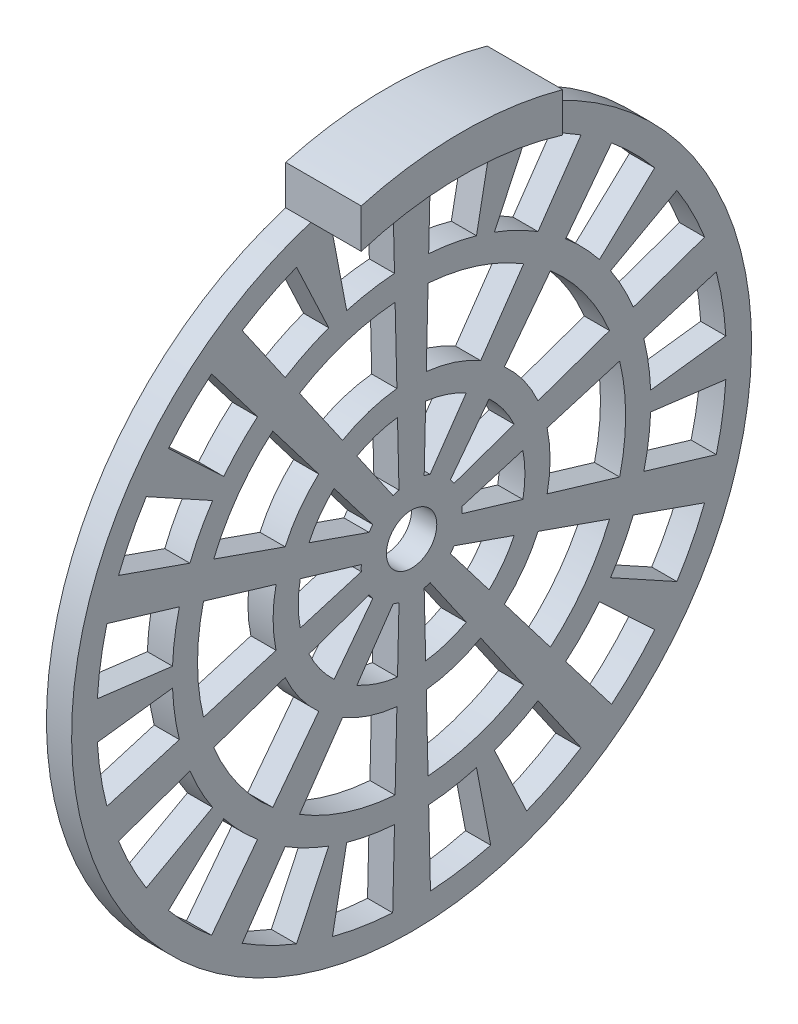
from build123d import *

# Parameters (mm, degrees)
EXTRUDE_START         = -2
EXTRUDE_1_OUTLINE_R   = 27
EXTRUDE_1_OUTLINE_R_2 = 2
EXTRUDE_1_DEPTH       = 2
EXTRUDE_2_DEPTH       = 6


# Read off the part's stored shape, not the designer's step: 填料-伸長1
with BuildPart() as part:
    # 填料-伸長1 outline → 填料-伸長1 (new body)
    with BuildSketch(Plane(origin=(-12, 0, 0), x_dir=(0, 0, -1), z_dir=(1, 0, 0)).offset(EXTRUDE_START)):
        with Locations((-180, -28.843045968)):
            Circle(EXTRUDE_1_OUTLINE_R)
        with BuildLine():
            ThreePointArc((-195.881160253, -48.150784029), (-197.677430395, -46.520954629), (-199.307308392, -44.724728582))
            Line((-199.307308392, -44.724728582), (-194.918503705, -40.609024347))
            ThreePointArc((-194.918503705, -40.609024347), (-193.648293098, -42.0613702), (-192.237337079, -43.377404613))
            Line((-192.237337079, -43.377404613), (-195.881160253, -48.150784029))
        make_face(mode=Mode.SUBTRACT)
        with BuildLine():
            ThreePointArc((-181.499324848, -53.798045968), (-183.910527604, -53.535307385), (-186.284921782, -53.040148237))
            Line((-186.284921782, -53.040148237), (-185.153454458, -47.130798896))
            ThreePointArc((-185.153454458, -47.130798896), (-183.272165017, -47.559160311), (-181.357132, -47.794515376))
            Line((-181.357132, -47.794515376), (-181.499324848, -53.798045968))
        make_face(mode=Mode.SUBTRACT)
        with BuildLine():
            ThreePointArc((-189.138091331, -52.113097253), (-191.350063817, -51.118055538), (-193.455201689, -49.913346097))
            Line((-193.455201689, -49.913346097), (-190.041451376, -44.972808963))
            ThreePointArc((-190.041451376, -44.972808963), (-188.353818884, -45.90803088), (-186.580039232, -46.667273404))
            Line((-186.580039232, -46.667273404), (-189.138091331, -52.113097253))
        make_face(mode=Mode.SUBTRACT)
        with BuildLine():
            ThreePointArc((-201.070664149, -42.297677599), (-202.275316635, -40.192507135), (-203.270298506, -37.98050773))
            Line((-203.270298506, -37.98050773), (-197.604541623, -35.990081315))
            ThreePointArc((-197.604541623, -35.990081315), (-196.788927907, -37.73865723), (-195.800181583, -39.395498855))
            Line((-195.800181583, -39.395498855), (-201.070664149, -42.297677599))
        make_face(mode=Mode.SUBTRACT)
        with BuildLine():
            ThreePointArc((-204.196932222, -35.128622396), (-204.692155609, -32.754241615), (-204.954959427, -30.343045968))
            Line((-204.954959427, -30.343045968), (-198.985191598, -29.593045968))
            ThreePointArc((-198.985191598, -29.593045968), (-198.811237104, -31.514629507), (-198.443295326, -33.408662852))
            Line((-198.443295326, -33.408662852), (-204.196932222, -35.128622396))
        make_face(mode=Mode.SUBTRACT)
        with BuildLine():
            ThreePointArc((-196.524631259, -32.83510831), (-197, -28.843045968), (-196.524631259, -24.850983626))
            Line((-196.524631259, -24.850983626), (-190.76327242, -26.573251523))
            ThreePointArc((-190.76327242, -26.573251523), (-191, -28.843045968), (-190.76327242, -31.112840413))
            Line((-190.76327242, -31.112840413), (-196.524631259, -32.83510831))
        make_face(mode=Mode.SUBTRACT)
        with BuildLine():
            ThreePointArc((-191.022232143, -41.785626799), (-193.753288904, -38.835395257), (-195.715182886, -35.326334244))
            Line((-195.715182886, -35.326334244), (-190.041822003, -33.333236483))
            ThreePointArc((-190.041822003, -33.333236483), (-188.899186938, -35.308683743), (-187.373518602, -37.005841042))
            Line((-187.373518602, -37.005841042), (-191.022232143, -41.785626799))
        make_face(mode=Mode.SUBTRACT)
        with BuildLine():
            ThreePointArc((-181.309714981, -45.792519313), (-185.253288904, -45.011006745), (-188.903068789, -43.3252891))
            Line((-188.903068789, -43.3252891), (-185.48473689, -38.378121282))
            ThreePointArc((-185.48473689, -38.378121282), (-183.399186938, -39.304667647), (-181.167331296, -39.780931397))
            Line((-181.167331296, -39.780931397), (-181.309714981, -45.792519313))
        make_face(mode=Mode.SUBTRACT)
        with BuildLine():
            ThreePointArc((-186.154879946, -35.409434082), (-187.281152949, -34.133113239), (-188.146968705, -32.667559129))
            Line((-188.146968705, -32.667559129), (-183.374409055, -30.990920157))
            ThreePointArc((-183.374409055, -30.990920157), (-183.236067977, -31.194186977), (-183.085499488, -31.388570062))
            Line((-183.085499488, -31.388570062), (-186.154879946, -35.409434082))
        make_face(mode=Mode.SUBTRACT)
        with BuildLine():
            ThreePointArc((-181.11977638, -37.773113205), (-182.781152949, -37.402554615), (-184.343043702, -36.725810166))
            Line((-184.343043702, -36.725810166), (-181.467465499, -32.564140566))
            ThreePointArc((-181.467465499, -32.564140566), (-181.236067978, -32.647272033), (-181, -32.716029314))
            Line((-181, -32.716029314), (-181.11977638, -37.773113205))
        make_face(mode=Mode.SUBTRACT)
        with BuildLine():
            ThreePointArc((-173.715078218, -53.040148237), (-176.089472396, -53.535307385), (-178.500675152, -53.798045968))
            Line((-178.500675152, -53.798045968), (-178.642868, -47.794515376))
            ThreePointArc((-178.642868, -47.794515376), (-176.727834983, -47.559160311), (-174.846545542, -47.130798896))
            Line((-174.846545542, -47.130798896), (-173.715078218, -53.040148237))
        make_face(mode=Mode.SUBTRACT)
        with BuildLine():
            ThreePointArc((-166.544798311, -49.913346097), (-168.649936183, -51.118055538), (-170.861908669, -52.113097253))
            Line((-170.861908669, -52.113097253), (-173.419960768, -46.667273404))
            ThreePointArc((-173.419960768, -46.667273404), (-171.646181116, -45.90803088), (-169.958548624, -44.972808963))
            Line((-169.958548624, -44.972808963), (-166.544798311, -49.913346097))
        make_face(mode=Mode.SUBTRACT)
        with BuildLine():
            ThreePointArc((-160.692691608, -44.724728582), (-162.322569605, -46.520954629), (-164.118839747, -48.150784029))
            Line((-164.118839747, -48.150784029), (-167.762662921, -43.377404613))
            ThreePointArc((-167.762662921, -43.377404613), (-166.351706902, -42.0613702), (-165.081496295, -40.609024347))
            Line((-165.081496295, -40.609024347), (-160.692691608, -44.724728582))
        make_face(mode=Mode.SUBTRACT)
        with BuildLine():
            ThreePointArc((-171.096931211, -43.3252891), (-174.746711096, -45.011006745), (-178.690285019, -45.792519313))
            Line((-178.690285019, -45.792519313), (-178.832668704, -39.780931397))
            ThreePointArc((-178.832668704, -39.780931397), (-176.600813062, -39.304667647), (-174.51526311, -38.378121282))
            Line((-174.51526311, -38.378121282), (-171.096931211, -43.3252891))
        make_face(mode=Mode.SUBTRACT)
        with BuildLine():
            ThreePointArc((-164.284817114, -35.326334244), (-166.246711096, -38.835395257), (-168.977767857, -41.785626799))
            Line((-168.977767857, -41.785626799), (-172.626481398, -37.005841042))
            ThreePointArc((-172.626481398, -37.005841042), (-171.100813062, -35.308683743), (-169.958177997, -33.333236483))
            Line((-169.958177997, -33.333236483), (-164.284817114, -35.326334244))
        make_face(mode=Mode.SUBTRACT)
        with BuildLine():
            ThreePointArc((-175.656956298, -36.725810166), (-177.218847051, -37.402554615), (-178.88022362, -37.773113205))
            Line((-178.88022362, -37.773113205), (-179, -32.716029314))
            ThreePointArc((-179, -32.716029314), (-178.763932022, -32.647272033), (-178.532534501, -32.564140566))
            Line((-178.532534501, -32.564140566), (-175.656956298, -36.725810166))
        make_face(mode=Mode.SUBTRACT)
        with BuildLine():
            ThreePointArc((-171.853031295, -32.667559129), (-172.718847051, -34.133113239), (-173.845120054, -35.409434082))
            Line((-173.845120054, -35.409434082), (-176.914500512, -31.388570062))
            ThreePointArc((-176.914500512, -31.388570062), (-176.763932023, -31.194186977), (-176.625590945, -30.990920157))
            Line((-176.625590945, -30.990920157), (-171.853031295, -32.667559129))
        make_face(mode=Mode.SUBTRACT)
        with BuildLine():
            ThreePointArc((-156.729701494, -37.98050773), (-157.724683365, -40.192507135), (-158.929335851, -42.297677599))
            Line((-158.929335851, -42.297677599), (-164.199818417, -39.395498855))
            ThreePointArc((-164.199818417, -39.395498855), (-163.211072093, -37.73865723), (-162.395458377, -35.990081315))
            Line((-162.395458377, -35.990081315), (-156.729701494, -37.98050773))
        make_face(mode=Mode.SUBTRACT)
        with BuildLine():
            ThreePointArc((-163.475368741, -24.850983626), (-163, -28.843045968), (-163.475368741, -32.83510831))
            Line((-163.475368741, -32.83510831), (-169.23672758, -31.112840413))
            ThreePointArc((-169.23672758, -31.112840413), (-169, -28.843045968), (-169.23672758, -26.573251523))
            Line((-169.23672758, -26.573251523), (-163.475368741, -24.850983626))
        make_face(mode=Mode.SUBTRACT)
        with BuildLine():
            ThreePointArc((-155.045040573, -30.343045968), (-155.307844391, -32.754241615), (-155.803067778, -35.128622396))
            Line((-155.803067778, -35.128622396), (-161.556704674, -33.408662852))
            ThreePointArc((-161.556704674, -33.408662852), (-161.188762896, -31.514629507), (-161.014808402, -29.593045968))
            Line((-161.014808402, -29.593045968), (-155.045040573, -30.343045968))
        make_face(mode=Mode.SUBTRACT)
        with BuildLine():
            ThreePointArc((-204.954959427, -27.343045968), (-204.692155609, -24.931850321), (-204.196932222, -22.55746954))
            Line((-204.196932222, -22.55746954), (-198.443295326, -24.277429084))
            ThreePointArc((-198.443295326, -24.277429084), (-198.811237104, -26.171462429), (-198.985191598, -28.093045968))
            Line((-198.985191598, -28.093045968), (-204.954959427, -27.343045968))
        make_face(mode=Mode.SUBTRACT)
        with BuildLine():
            ThreePointArc((-203.270298506, -19.705584207), (-202.275316635, -17.493584801), (-201.070664149, -15.388414337))
            Line((-201.070664149, -15.388414337), (-195.800181583, -18.290593081))
            ThreePointArc((-195.800181583, -18.290593081), (-196.788927907, -19.947434706), (-197.604541623, -21.696010621))
            Line((-197.604541623, -21.696010621), (-203.270298506, -19.705584207))
        make_face(mode=Mode.SUBTRACT)
        with BuildLine():
            ThreePointArc((-188.839028568, -30.537617882), (-189, -28.843045968), (-188.839028568, -27.148474054))
            Line((-188.839028568, -27.148474054), (-183.992443043, -28.597284811))
            ThreePointArc((-183.992443043, -28.597284811), (-184, -28.843045968), (-183.992443043, -29.088807125))
            Line((-183.992443043, -29.088807125), (-188.839028568, -30.537617882))
        make_face(mode=Mode.SUBTRACT)
        with BuildLine():
            ThreePointArc((-188.146968705, -25.018532808), (-187.28115295, -23.552978698), (-186.154879946, -22.276657855))
            Line((-186.154879946, -22.276657855), (-183.085499488, -26.297521874))
            ThreePointArc((-183.085499488, -26.297521874), (-183.236067977, -26.491904959), (-183.374409055, -26.695171779))
            Line((-183.374409055, -26.695171779), (-188.146968705, -25.018532808))
        make_face(mode=Mode.SUBTRACT)
        with BuildLine():
            ThreePointArc((-184.343043702, -20.96028177), (-182.781152949, -20.283537321), (-181.11977638, -19.912978731))
            Line((-181.11977638, -19.912978731), (-181, -24.970062622))
            ThreePointArc((-181, -24.970062622), (-181.236067978, -25.038819903), (-181.467465499, -25.12195137))
            Line((-181.467465499, -25.12195137), (-184.343043702, -20.96028177))
        make_face(mode=Mode.SUBTRACT)
        with BuildLine():
            ThreePointArc((-195.715182886, -22.359757692), (-193.753288904, -18.850696679), (-191.022232143, -15.900465137))
            Line((-191.022232143, -15.900465137), (-187.373518602, -20.680250894))
            ThreePointArc((-187.373518602, -20.680250894), (-188.899186938, -22.377408193), (-190.041822003, -24.352855453))
            Line((-190.041822003, -24.352855453), (-195.715182886, -22.359757692))
        make_face(mode=Mode.SUBTRACT)
        with BuildLine():
            ThreePointArc((-188.903068789, -14.360802836), (-185.253288904, -12.675085191), (-181.309714981, -11.893572623))
            Line((-181.309714981, -11.893572623), (-181.167331296, -17.90516054))
            ThreePointArc((-181.167331296, -17.90516054), (-183.399186938, -18.381424289), (-185.48473689, -19.307970654))
            Line((-185.48473689, -19.307970654), (-188.903068789, -14.360802836))
        make_face(mode=Mode.SUBTRACT)
        with BuildLine():
            ThreePointArc((-199.307308392, -12.961363354), (-197.677430395, -11.165137307), (-195.881160253, -9.535307908))
            Line((-195.881160253, -9.535307908), (-192.237337079, -14.308687323))
            ThreePointArc((-192.237337079, -14.308687323), (-193.648293098, -15.624721736), (-194.918503705, -17.077067589))
            Line((-194.918503705, -17.077067589), (-199.307308392, -12.961363354))
        make_face(mode=Mode.SUBTRACT)
        with BuildLine():
            ThreePointArc((-193.455201689, -7.772745839), (-191.350063817, -6.568036398), (-189.138091331, -5.572994683))
            Line((-189.138091331, -5.572994683), (-186.580039232, -11.018818532))
            ThreePointArc((-186.580039232, -11.018818532), (-188.353818884, -11.778061056), (-190.041451376, -12.713282974))
            Line((-190.041451376, -12.713282974), (-193.455201689, -7.772745839))
        make_face(mode=Mode.SUBTRACT)
        with BuildLine():
            ThreePointArc((-186.284921782, -4.6459437), (-183.910527604, -4.150784552), (-181.499324848, -3.888045968))
            Line((-181.499324848, -3.888045968), (-181.357132, -9.89157656))
            ThreePointArc((-181.357132, -9.89157656), (-183.272165017, -10.126931625), (-185.153454458, -10.55529304))
            Line((-185.153454458, -10.55529304), (-186.284921782, -4.6459437))
        make_face(mode=Mode.SUBTRACT)
        with Locations((-180, -28.843045968)):
            Circle(EXTRUDE_1_OUTLINE_R_2, mode=Mode.SUBTRACT)
        with BuildLine():
            ThreePointArc((-171.160971432, -27.148474054), (-171, -28.843045968), (-171.160971432, -30.537617882))
            Line((-171.160971432, -30.537617882), (-176.007556957, -29.088807125))
            ThreePointArc((-176.007556957, -29.088807125), (-176, -28.843045968), (-176.007556957, -28.597284811))
            Line((-176.007556957, -28.597284811), (-171.160971432, -27.148474054))
        make_face(mode=Mode.SUBTRACT)
        with BuildLine():
            ThreePointArc((-178.88022362, -19.912978731), (-177.218847051, -20.283537321), (-175.656956298, -20.96028177))
            Line((-175.656956298, -20.96028177), (-178.532534501, -25.12195137))
            ThreePointArc((-178.532534501, -25.12195137), (-178.763932022, -25.038819903), (-179, -24.970062622))
            Line((-179, -24.970062622), (-178.88022362, -19.912978731))
        make_face(mode=Mode.SUBTRACT)
        with BuildLine():
            ThreePointArc((-173.845120054, -22.276657855), (-172.71884705, -23.552978698), (-171.853031295, -25.018532808))
            Line((-171.853031295, -25.018532808), (-176.625590945, -26.695171779))
            ThreePointArc((-176.625590945, -26.695171779), (-176.763932023, -26.491904959), (-176.914500512, -26.297521874))
            Line((-176.914500512, -26.297521874), (-173.845120054, -22.276657855))
        make_face(mode=Mode.SUBTRACT)
        with BuildLine():
            ThreePointArc((-178.690285019, -11.893572623), (-174.746711096, -12.675085191), (-171.096931211, -14.360802836))
            Line((-171.096931211, -14.360802836), (-174.51526311, -19.307970654))
            ThreePointArc((-174.51526311, -19.307970654), (-176.600813062, -18.381424289), (-178.832668704, -17.90516054))
            Line((-178.832668704, -17.90516054), (-178.690285019, -11.893572623))
        make_face(mode=Mode.SUBTRACT)
        with BuildLine():
            ThreePointArc((-168.977767857, -15.900465137), (-166.246711096, -18.850696679), (-164.284817114, -22.359757692))
            Line((-164.284817114, -22.359757692), (-169.958177997, -24.352855453))
            ThreePointArc((-169.958177997, -24.352855453), (-171.100813062, -22.377408193), (-172.626481398, -20.680250894))
            Line((-172.626481398, -20.680250894), (-168.977767857, -15.900465137))
        make_face(mode=Mode.SUBTRACT)
        with BuildLine():
            ThreePointArc((-155.803067778, -22.55746954), (-155.307844391, -24.931850321), (-155.045040573, -27.343045968))
            Line((-155.045040573, -27.343045968), (-161.014808402, -28.093045968))
            ThreePointArc((-161.014808402, -28.093045968), (-161.188762896, -26.171462429), (-161.556704674, -24.277429084))
            Line((-161.556704674, -24.277429084), (-155.803067778, -22.55746954))
        make_face(mode=Mode.SUBTRACT)
        with BuildLine():
            ThreePointArc((-158.929335851, -15.388414337), (-157.724683365, -17.493584801), (-156.729701494, -19.705584207))
            Line((-156.729701494, -19.705584207), (-162.395458377, -21.696010621))
            ThreePointArc((-162.395458377, -21.696010621), (-163.211072093, -19.947434706), (-164.199818417, -18.290593081))
            Line((-164.199818417, -18.290593081), (-158.929335851, -15.388414337))
        make_face(mode=Mode.SUBTRACT)
        with BuildLine():
            ThreePointArc((-170.861908669, -5.572994683), (-168.649936183, -6.568036398), (-166.544798311, -7.772745839))
            Line((-166.544798311, -7.772745839), (-169.958548624, -12.713282974))
            ThreePointArc((-169.958548624, -12.713282974), (-171.646181116, -11.778061056), (-173.419960768, -11.018818532))
            Line((-173.419960768, -11.018818532), (-170.861908669, -5.572994683))
        make_face(mode=Mode.SUBTRACT)
        with BuildLine():
            ThreePointArc((-178.500675152, -3.888045968), (-176.089472396, -4.150784552), (-173.715078218, -4.6459437))
            Line((-173.715078218, -4.6459437), (-174.846545542, -10.55529304))
            ThreePointArc((-174.846545542, -10.55529304), (-176.727834983, -10.126931625), (-178.642868, -9.89157656))
            Line((-178.642868, -9.89157656), (-178.500675152, -3.888045968))
        make_face(mode=Mode.SUBTRACT)
        with BuildLine():
            ThreePointArc((-164.118839747, -9.535307908), (-162.322569605, -11.165137307), (-160.692691608, -12.961363354))
            Line((-160.692691608, -12.961363354), (-165.081496295, -17.077067589))
            ThreePointArc((-165.081496295, -17.077067589), (-166.351706902, -15.624721736), (-167.762662921, -14.308687323))
            Line((-167.762662921, -14.308687323), (-164.118839747, -9.535307908))
        make_face(mode=Mode.SUBTRACT)
    extrude(amount=EXTRUDE_1_DEPTH)

    # 草圖3 → 填料-伸長2 (add)
    with BuildSketch(Plane.ZY.offset(14)):
        with BuildLine():
            Line((188, -3.055452052), (188, 0.070618621))
            ThreePointArc((188, 0.070618621), (180, 1.156954032), (172, 0.070618621))
            Line((172, 0.070618621), (172, -3.055452052))
            ThreePointArc((172, -3.055452052), (180, -1.843045968), (188, -3.055452052))
        make_face()
    extrude(amount=-EXTRUDE_2_DEPTH)


solid = part.part
